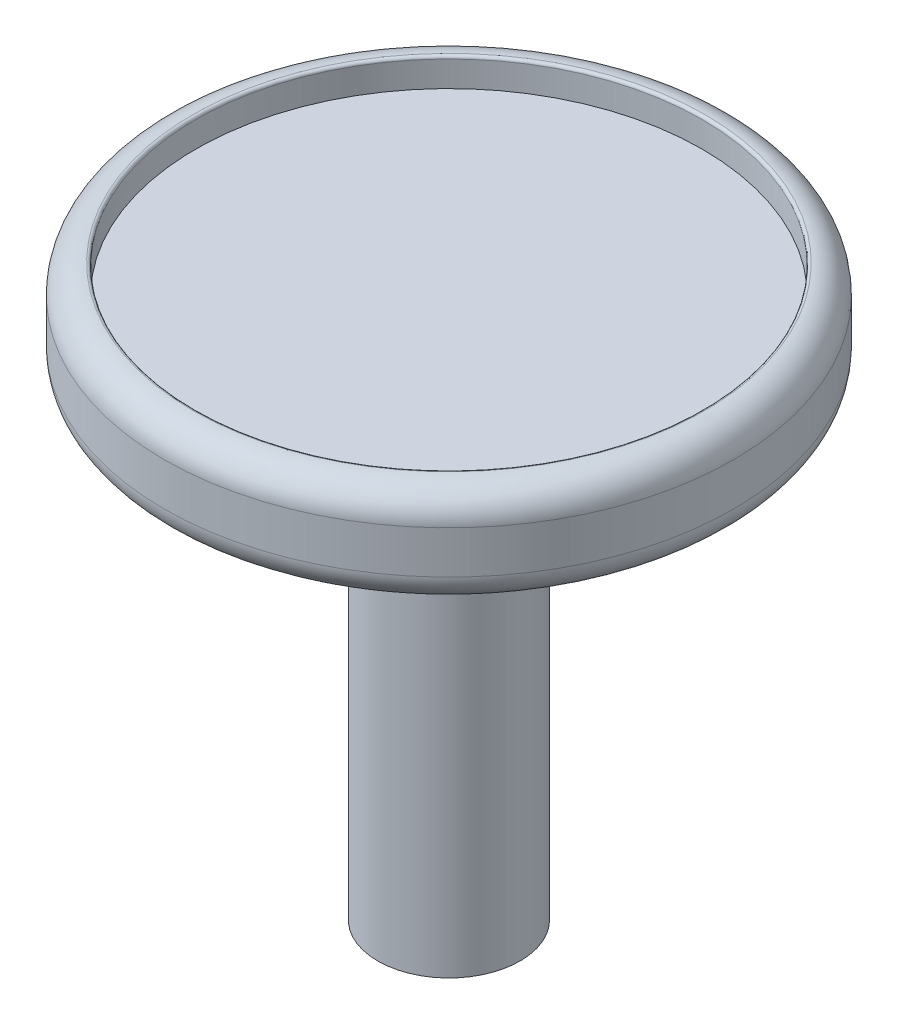
from build123d import *

# Parameters (mm, degrees)
SKETCH2_R           = 2.5
SKETCH2_W           = 2.05
SKETCH2_H           = 1.3
BOSS_EXTRUDE1_DEPTH = 10
FILLET1_R           = 1
SKETCH3_W           = 2.05
SKETCH3_H           = 1.3
BOSS_EXTRUDE5_DEPTH = 16
SKETCH4_R           = 10
THUMB_STICK_DEPTH   = 3.5
FILLET2_R           = 1
FILLET3_R           = 1
SKETCH4_4_R         = 8.9
CUT_EXTRUDE1_DEPTH  = 1
FILLET5_R           = 0.1


with BuildPart() as part:
    # Sketch2 → Boss-Extrude1 (new, symmetric)
    with BuildSketch(Plane(origin=(0, 0, 0), x_dir=(1, 0, 0), z_dir=(0, 1, 0))):
        with Locations(Location((0, 0, 0), (0, 0, 270))):
            Circle(SKETCH2_R)
        Rectangle(SKETCH2_W, SKETCH2_H, mode=Mode.SUBTRACT)
    extrude(amount=BOSS_EXTRUDE1_DEPTH, both=True)

    # Fillet1
    fillet1_edges = [part.edges().sort_by_distance(p)[0] for p in [
        (0, 10, -2.5),
    ]]
    fillet(fillet1_edges, radius=FILLET1_R)

    # Sketch3 → Boss-Extrude5 (add)
    with BuildSketch(Plane(origin=(0, 10, 0), x_dir=(1, 0, 0), z_dir=(0, 1, 0))):
        Rectangle(SKETCH3_W, SKETCH3_H)
    extrude(amount=-BOSS_EXTRUDE5_DEPTH)

    # Sketch4 → Thumb Stick (add)
    with BuildSketch(Plane(origin=(0, 10, 0), x_dir=(1, 0, 0), z_dir=(0, 1, 0))):
        with Locations(Location((0, 0, 0), (0, 0, 270))):
            Circle(SKETCH4_R)
    extrude(amount=-THUMB_STICK_DEPTH)

    # Fillet2
    fillet2_edges = [part.edges().sort_by_distance(p)[0] for p in [
        (0, 6.5, -10),
    ]]
    fillet(fillet2_edges, radius=FILLET2_R)

    # Fillet3
    fillet3_edges = [part.edges().sort_by_distance(p)[0] for p in [
        (0, 10, -10),
    ]]
    fillet(fillet3_edges, radius=FILLET3_R)

    # Sketch4<4> → Cut-Extrude1 (cut)
    with BuildSketch(Plane(origin=(0, 10, 0), x_dir=(1, 0, 0), z_dir=(0, 1, 0))):
        with Locations(Location((0, 0, 0), (0, 0, 270))):
            Circle(SKETCH4_4_R)
    extrude(amount=-CUT_EXTRUDE1_DEPTH, mode=Mode.SUBTRACT)

    # Fillet5
    fillet5_edges = [part.edges().sort_by_distance(p)[0] for p in [
        (0, 10, -8.9),
    ]]
    fillet(fillet5_edges, radius=FILLET5_R - 0.0001)  # a hair under: the kernel refuses the full size


solid = part.part
